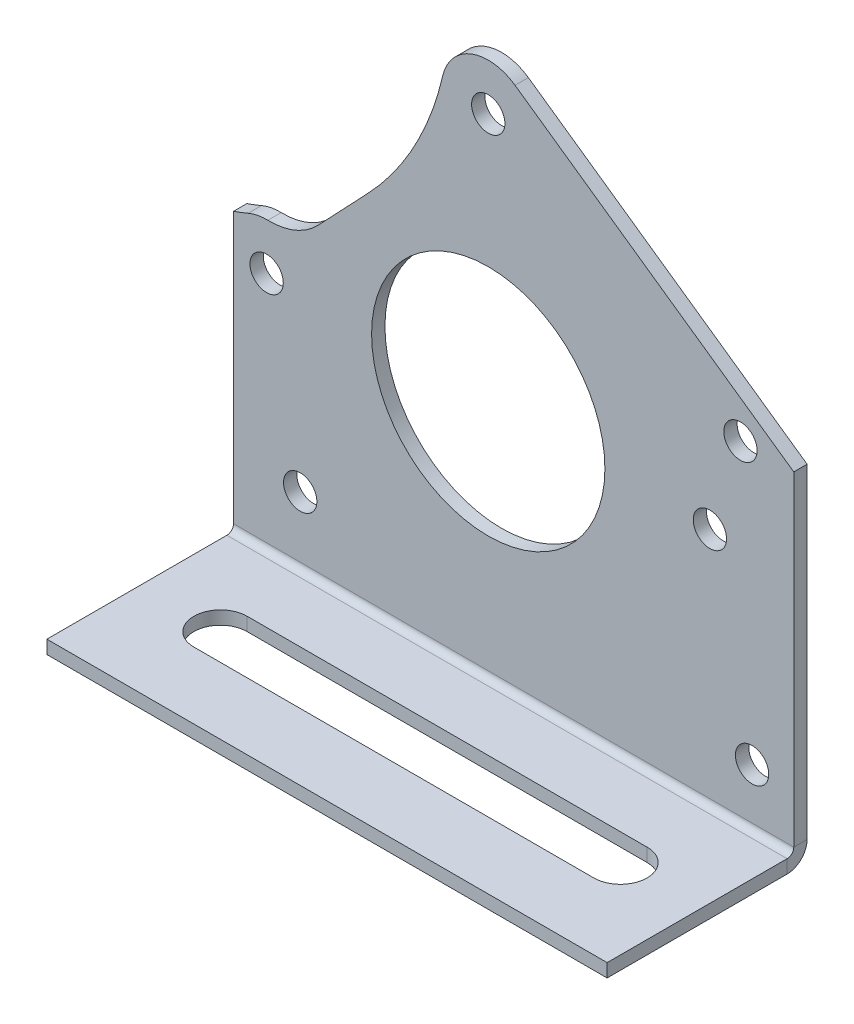
from build123d import *

# Parameters (mm, degrees)
SKETCH1_R                  = 2.138138955
SKETCH1_R_2                = 2.5
SKETCH1_R_3                = 17.5
BOSS_EXTRUDE1_DEPTH        = 4
FILLET4_R                  = 10
FILLET8_R                  = 30
SKETCH2_R                  = 2
BOSS_EXTRUDE2_DEPTH        = 4
FILLET10_R                 = 4
SKETCH3_R                  = 2.5
SKETCH3_R_2                = 2.138138955
BOSS_EXTRUDE3_DEPTH        = 4
SKETCH4_W                  = 172.930913202
SKETCH4_H                  = 8.75
BOSS_EXTRUDE4_DEPTH        = 4
CUT_EXTRUDE1_REACH         = 123.687
CONVERT_SOLID1_START       = 2
CONVERT_SOLID1_OUTLINE_R   = 2.138138955
CONVERT_SOLID1_OUTLINE_R_2 = 2.5
CONVERT_SOLID1_OUTLINE_R_3 = 17.5
CONVERT_SOLID1_OUTLINE_R_4 = 2
CONVERT_SOLID1_DEPTH       = 2
EDGE_FLANGE1_DEPTH         = 159.04353712
CUT_EXTRUDE2_REACH         = 144.058
CUT_EXTRUDE3_REACH         = 126.803
SKETCH15_R                 = 2.5
CUT_EXTRUDE4_DEPTH         = 126.266876508
CUT_EXTRUDE4_DEPTH_BACK    = 126.266876508
SKETCH16_W                 = 75
SKETCH16_H                 = 51.529180682
SKETCH17_R                 = 2.5
CUT_EXTRUDE5_DEPTH         = 70.648854106


# Read off the part's stored shape, not the designer's step: Convert-Solid1
# Sheet-metal steps are written as plain solids
with BuildPart() as part:
    # Sketch1 → Boss-Extrude1 (new body)
    with BuildSketch(Plane.XY):
        with BuildLine():
            Line((57.269086776, 5.73122513), (4.019086776, 43.073392983))
            ThreePointArc((4.019086776, 43.073392983), (-2.50930732, 43.876949929), (-6.822053045, 38.910476579))
            ThreePointArc((-6.822053045, 38.910476579), (-11.022997654, 27.721065982), (-18.021357649, 18.032216591))
            Line((-18.021357649, 18.032216591), (-29.508168792, 5.915969846))
            ThreePointArc((-29.508168792, 5.915969846), (-34.635809661, 6.861452586), (-38.994562647, 4))
            Line((-38.994562647, 4), (-49.854306759, 4))
            ThreePointArc((-49.854306759, 4), (-50.678108889, 3.992458813), (-51.501911019, 4))
            Line((-51.501911019, 4), (-103.25, 4))
            ThreePointArc((-103.25, 4), (-113.23757059, -5.501568758), (-104.245623443, -15.950313259))
            Line((-104.245623443, -15.950313259), (-2.613511537, -26.119572306))
            ThreePointArc((-2.613511537, -26.119572306), (3.534961315, -26.010892882), (9.48943662, -24.474743975))
            Line((9.48943662, -24.474743975), (55.780516432, -6.526598393))
            ThreePointArc((55.780516432, -6.526598393), (60.198948476, -0.84386911), (57.269086776, 5.73122513))
        make_face()
        with Locations((-93.25, -6)):
            Circle(SKETCH1_R, mode=Mode.SUBTRACT)
        with Locations((-69.427494877, -8.934369314)):
            Circle(SKETCH1_R_2, mode=Mode.SUBTRACT)
        with Locations((-43.206195341, -14.414354512)):
            Circle(SKETCH1_R_2, mode=Mode.SUBTRACT)
        with Locations((-33.25, 0)):
            Circle(SKETCH1_R_2, mode=Mode.SUBTRACT)
        Circle(SKETCH1_R_3, mode=Mode.SUBTRACT)
        with Locations((33.25, 0)):
            Circle(SKETCH1_R_2, mode=Mode.SUBTRACT)
        with Locations((53.25, 0)):
            Circle(SKETCH1_R_2, mode=Mode.SUBTRACT)
        with Locations((0, 37.342167854)):
            Circle(SKETCH1_R_2, mode=Mode.SUBTRACT)
    extrude(amount=BOSS_EXTRUDE1_DEPTH)

    # Fillet4
    fillet4_edges = [part.edges().sort_by_distance(p)[0] for p in [
        (-29.508168792, 5.915969846, 2),
    ]]
    fillet(fillet4_edges, radius=FILLET4_R)

    # Fillet8
    fillet8_edges = [part.edges().sort_by_distance(p)[0] for p in [
        (-38.994562647, 4, 2),
    ]]
    fillet(fillet8_edges, radius=FILLET8_R)

    # Sketch2 → Boss-Extrude2 (add, through all)
    with BuildSketch(Plane(origin=(0, 0, 0), x_dir=(-1, 0, 0), z_dir=(0, 0, -1))):
        Polygon((113.243669527, -5.64423408), (112.561112682, 13.529180682), (98.666188695, 13.529180682), (98.666188695, 2.111142935), align=None)
        with Locations((105.421921095, 7.587030731)):
            Circle(SKETCH2_R, mode=Mode.SUBTRACT)
    extrude(amount=-BOSS_EXTRUDE2_DEPTH)

    # Fillet10
    fillet10_edges = [part.edges().sort_by_distance(p)[0] for p in [
        (-98.666188695, 4, 2),
        (-98.666188695, 13.529180682, 2),
        (-112.561112682, 13.529180682, 2),
    ]]
    fillet(fillet10_edges, radius=FILLET10_R)

    # Sketch3 → Boss-Extrude3 (add)
    # profile 1 of 4: a face of its own
    with BuildSketch(Plane(origin=(0, 0, 0), x_dir=(-1, 0, 0), z_dir=(0, 0, -1))):
        with BuildLine():
            Line((-59.721152147, -26.25), (0, -26.25))
            ThreePointArc((0, -26.25), (-4.827031731, -25.802369362), (-9.48943662, -24.474743975))
            Line((-9.48943662, -24.474743975), (-55.780516432, -6.526598393))
            ThreePointArc((-55.780516432, -6.526598393), (-58.776157504, -4.296694455), (-60.198948476, -0.84386911))
            Line((-60.198948476, -0.84386911), (-59.721152147, -26.25))
        make_face()
    # profile 2 of 4: a face of its own
    with BuildSketch(Plane(origin=(0, 0, 0), x_dir=(-1, 0, 0), z_dir=(0, 0, -1))):
        with BuildLine():
            ThreePointArc((-9.48943662, -24.474743975), (-4.827031731, -25.802369362), (0, -26.25))
            Line((0, -26.25), (-50.316238181, 5.820300559))
            Line((-50.316238181, 5.820300559), (-60.198948476, -0.84386911))
            ThreePointArc((-60.198948476, -0.84386911), (-58.776157504, -4.296694455), (-55.780516432, -6.526598393))
            Line((-55.780516432, -6.526598393), (-9.48943662, -24.474743975))
        make_face()
        with Locations(Location((-53.25, 0, 0), (0, 0, 180))):
            Circle(SKETCH3_R, mode=Mode.SUBTRACT)
    # profile 3 of 4: a face of its own
    with BuildSketch(Plane(origin=(0, 0, 0), x_dir=(-1, 0, 0), z_dir=(0, 0, -1))):
        with BuildLine():
            Line((30.255475695, -5.847942527), (0, -26.25))
            ThreePointArc((0, -26.25), (1.30838201, -26.2173728), (2.613511537, -26.119572306))
            Line((2.613511537, -26.119572306), (104.245623443, -15.950313259))
            ThreePointArc((104.245623443, -15.950313259), (110.356292372, -13.0356669), (113.209761055, -6.896191789))
            Line((113.209761055, -6.896191789), (113.209761055, -4.69172559))
            Line((113.209761055, -4.69172559), (113.006516175, 1.017540127))
            Line((113.006516175, 1.017540127), (30.255475695, -5.847942527))
        make_face()
        with Locations(Location((43.206195341, -14.414354512, 0), (0, 0, 180))):
            Circle(SKETCH3_R, mode=Mode.SUBTRACT)
        with Locations(Location((69.427494877, -8.934369314, 0), (0, 0, 180))):
            Circle(SKETCH3_R, mode=Mode.SUBTRACT)
        with Locations(Location((93.25, -6, 0), (0, 0, 180))):
            Circle(SKETCH3_R_2, mode=Mode.SUBTRACT)
    # profile 4 of 4: a face of its own
    with BuildSketch(Plane(origin=(0, 0, 0), x_dir=(-1, 0, 0), z_dir=(0, 0, -1))):
        with BuildLine():
            ThreePointArc((2.613511537, -26.119572306), (1.30838201, -26.2173728), (0, -26.25))
            Line((0, -26.25), (113.209761055, -26.25))
            Line((113.209761055, -26.25), (113.209761055, -6.896191789))
            ThreePointArc((113.209761055, -6.896191789), (110.356292372, -13.0356669), (104.245623443, -15.950313259))
            Line((104.245623443, -15.950313259), (2.613511537, -26.119572306))
        make_face()
    extrude(amount=-BOSS_EXTRUDE3_DEPTH)

    # Sketch4 → Boss-Extrude4 (add)
    with BuildSketch(Plane(origin=(0, 0, 0), x_dir=(-1, 0, 0), z_dir=(0, 0, -1))):
        with Locations((26.744304454, -30.625)):
            Rectangle(SKETCH4_W, SKETCH4_H)
    extrude(amount=-BOSS_EXTRUDE4_DEPTH)

    # Sketch5 → Cut-Extrude1 (cut, up to next)
    with BuildSketch(Plane(origin=(0, 0, 0), x_dir=(-1, 0, 0), z_dir=(0, 0, -1)), mode=Mode.PRIVATE) as cut_extrude1_sk1:
        Polygon((-45.833776065, 13.750366764), (-45.833776065, -35), (-59.721152147, -35), (-65.850826746, 7.196032961), align=None)
    cut_extrude1_tool1 = extrude(cut_extrude1_sk1.sketch, amount=-CUT_EXTRUDE1_REACH, mode=Mode.PRIVATE) & part.part
    add(cut_extrude1_tool1.solids().sort_by_distance((54.242954, -10.781509, 0))[0], mode=Mode.SUBTRACT)

    # Convert-Solid1 outline → Convert-Solid1 (cut)
    with BuildSketch(Plane.XY.offset(CONVERT_SOLID1_START)):
        with BuildLine():
            ThreePointArc((-33.058799925, 6.997388265), (-34.565645358, 6.875251071), (-36.011125314, 6.432432432))
            ThreePointArc((-36.011125314, 6.432432432), (-41.804115022, 4.614399555), (-47.844519519, 4))
            Line((-47.844519519, 4), (-49.854306759, 4))
            ThreePointArc((-49.854306759, 4), (-50.678108889, 3.992458813), (-51.501911019, 4))
            Line((-51.501911019, 4), (-94.666188695, 4))
            ThreePointArc((-94.666188695, 4), (-97.49461582, 5.171572875), (-98.666188695, 8))
            Line((-98.666188695, 8), (-98.666188695, 9.529180682))
            ThreePointArc((-98.666188695, 9.529180682), (-99.837761571, 12.357607807), (-102.666188695, 13.529180682))
            Line((-102.666188695, 13.529180682), (-108.700975401, 13.529180682))
            ThreePointArc((-108.700975401, 13.529180682), (-111.478633995, 12.407481003), (-112.698443211, 9.67148705))
            Line((-112.698443211, 9.67148705), (-113.243669527, -5.64423408))
            ThreePointArc((-113.243669527, -5.64423408), (-113.246334204, -6.2707443), (-113.209761055, -6.896191789))
            Line((-113.209761055, -6.896191789), (-113.209761055, -35))
            Line((-113.209761055, -35), (45.833776065, -35))
            Line((45.833776065, -35), (45.833776065, 13.750366764))
            Line((45.833776065, 13.750366764), (4.019086776, 43.073392983))
            ThreePointArc((4.019086776, 43.073392983), (-2.509307476, 43.876949869), (-6.82205312, 38.910476252))
            ThreePointArc((-6.82205312, 38.910476252), (-11.022997734, 27.721065834), (-18.021357649, 18.032216591))
            Line((-18.021357649, 18.032216591), (-25.528601129, 10.113603388))
            ThreePointArc((-25.528601129, 10.113603388), (-28.96185533, 7.75360629), (-33.058799925, 6.997388265))
        make_face()
        with Locations((-93.25, -6)):
            Circle(CONVERT_SOLID1_OUTLINE_R, mode=Mode.SUBTRACT)
        with Locations((-69.427494877, -8.934369314)):
            Circle(CONVERT_SOLID1_OUTLINE_R_2, mode=Mode.SUBTRACT)
        with Locations((-43.206195341, -14.414354512)):
            Circle(CONVERT_SOLID1_OUTLINE_R_2, mode=Mode.SUBTRACT)
        with Locations((-33.25, 0)):
            Circle(CONVERT_SOLID1_OUTLINE_R_2, mode=Mode.SUBTRACT)
        Circle(CONVERT_SOLID1_OUTLINE_R_3, mode=Mode.SUBTRACT)
        with Locations((33.25, 0)):
            Circle(CONVERT_SOLID1_OUTLINE_R_2, mode=Mode.SUBTRACT)
        with Locations((-105.421921095, 7.587030731)):
            Circle(CONVERT_SOLID1_OUTLINE_R_4, mode=Mode.SUBTRACT)
        with Locations((0, 37.342167854)):
            Circle(CONVERT_SOLID1_OUTLINE_R_2, mode=Mode.SUBTRACT)
    extrude(amount=CONVERT_SOLID1_DEPTH, mode=Mode.SUBTRACT)

    # Edge-Flange1 section (across the edge) → Edge-Flange1 (add)
    with BuildSketch(Plane(origin=(-113.209761055, -36, 2), x_dir=(0, 1, 0), z_dir=(1, 0, 0))):
        with BuildLine():
            Line((-2, 1), (-2, 28))
            Line((-2, 28), (0, 28))
            Line((0, 28), (0, 1))
            ThreePointArc((0, 1), (0.292893219, 0.292893219), (1, 0))
            Line((1, 0), (1, -2))
            ThreePointArc((1, -2), (-1.121320344, -1.121320344), (-2, 1))
        make_face()
    extrude(amount=EDGE_FLANGE1_DEPTH)

    # Sketch14 → Cut-Extrude2 (cut, up to next)
    with BuildSketch(Plane(origin=(0, -36, 0), x_dir=(1, 0, 0), z_dir=(0, 1, 0)), mode=Mode.PRIVATE) as cut_extrude2_sk1:
        with BuildLine():
            Line((-26.166223935, -12), (33.833776065, -12))
            ThreePointArc((33.833776065, -12), (37.833776065, -16), (33.833776065, -20))
            Line((33.833776065, -20), (-26.166223935, -20))
            ThreePointArc((-26.166223935, -20), (-30.166223935, -16), (-26.166223935, -12))
        make_face()
    cut_extrude2_tool1 = extrude(cut_extrude2_sk1.sketch, amount=-CUT_EXTRUDE2_REACH, mode=Mode.PRIVATE) & part.part
    add(cut_extrude2_tool1.solids().sort_by_distance((3.833776, -36, 16))[0], mode=Mode.SUBTRACT)

    # Sketch15 → Cut-Extrude3 (cut, up to next)
    with BuildSketch(Plane.XY.offset(2), mode=Mode.PRIVATE) as cut_extrude3_sk1:
        with Locations((-105.421921095, 7.587030731)):
            Circle(SKETCH15_R)
    cut_extrude3_tool1 = extrude(cut_extrude3_sk1.sketch, amount=-CUT_EXTRUDE3_REACH, mode=Mode.PRIVATE) & part.part
    # Sketch15 → Cut-Extrude3 (cut, up to next)
    with BuildSketch(Plane.XY.offset(2), mode=Mode.PRIVATE) as cut_extrude3_sk2:
        with Locations((-105.421921095, -27.412969269)):
            Circle(SKETCH15_R)
    cut_extrude3_tool2 = extrude(cut_extrude3_sk2.sketch, amount=-CUT_EXTRUDE3_REACH, mode=Mode.PRIVATE) & part.part
    # Sketch15 → Cut-Extrude3 (cut, up to next)
    with BuildSketch(Plane.XY.offset(2), mode=Mode.PRIVATE) as cut_extrude3_sk3:
        with Locations((39.578078905, -27.412969269)):
            Circle(SKETCH15_R)
    cut_extrude3_tool3 = extrude(cut_extrude3_sk3.sketch, amount=-CUT_EXTRUDE3_REACH, mode=Mode.PRIVATE) & part.part
    add(cut_extrude3_tool1.solids().sort_by_distance((-105.421921, 7.587031, 2))[0], mode=Mode.SUBTRACT)
    add(cut_extrude3_tool2.solids().sort_by_distance((-105.421921, -27.412969, 2))[0], mode=Mode.SUBTRACT)
    add(cut_extrude3_tool3.solids().sort_by_distance((39.578079, -27.412969, 2))[0], mode=Mode.SUBTRACT)

    # Sketch16 → Cut-Extrude4 (cut, two sides: drawn at the far end of the back side and taken through both)
    with BuildSketch(Plane(origin=(0, 0, 0), x_dir=(-1, 0, 0), z_dir=(0, 0, -1)).offset(-CUT_EXTRUDE4_DEPTH_BACK)):
        with Locations((75.709761055, -12.235409659)):
            Rectangle(SKETCH16_W, SKETCH16_H)
    extrude(amount=CUT_EXTRUDE4_DEPTH + CUT_EXTRUDE4_DEPTH_BACK, mode=Mode.SUBTRACT)


with BuildPart() as cut_extrude4_kept_piece:
    # of the separate pieces the step leaves, the one the design keeps (cut_extrude4_pieces_kept)
    add(part.part.solids().sort_by_distance((-36.011125314, 6.432432432, 0))[0])

    # Sketch17 → Cut-Extrude5 (cut, through all)
    with BuildSketch(Plane.XY.offset(2)):
        with Locations((-28.209761055, -25.881079341)):
            Circle(SKETCH17_R)
        with Locations((37.833776065, 13.750366764)):
            Circle(SKETCH17_R)
    extrude(amount=-CUT_EXTRUDE5_DEPTH, mode=Mode.SUBTRACT)


solid = cut_extrude4_kept_piece.part
